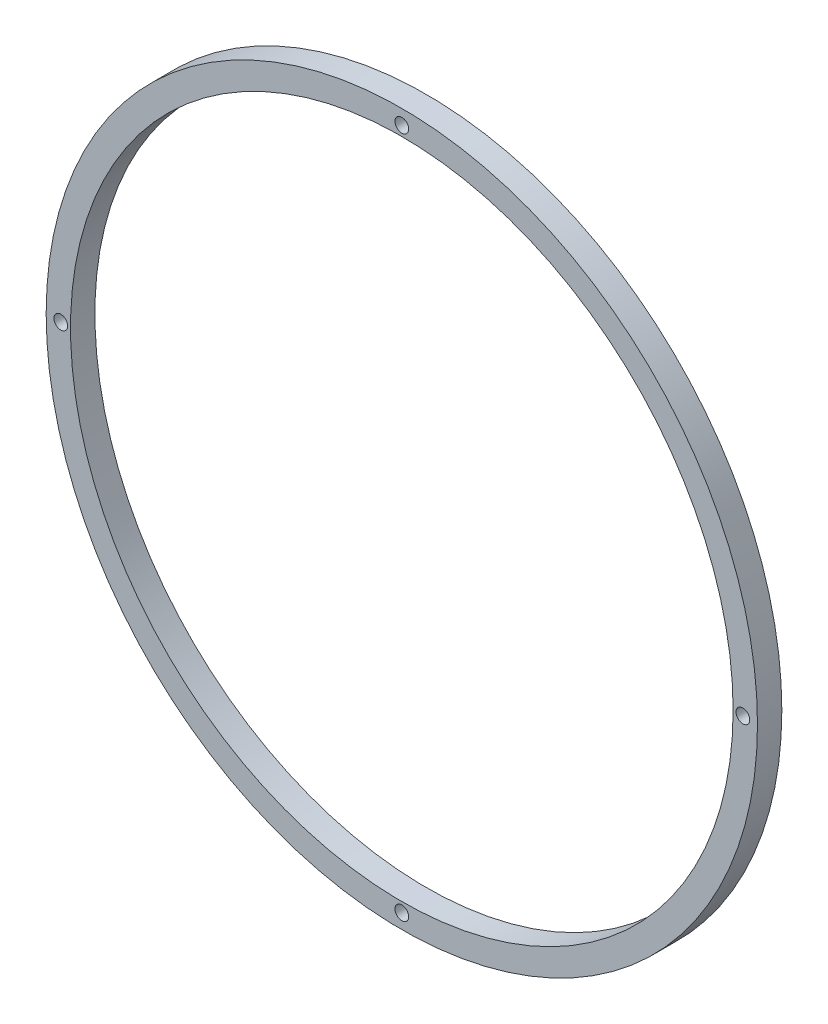
from build123d import *

# Parameters (mm, degrees)
SKETCH1_R           = 92.71
SKETCH1_R_2         = 1.7859375
SKETCH1_R_3         = 86.36
BOSS_EXTRUDE1_DEPTH = 6.35


with BuildPart() as part:
    # Sketch1 → Boss-Extrude1 (new body)
    with BuildSketch(Plane.XY):
        Circle(SKETCH1_R)
        with Locations((-88.9, 0)):
            Circle(SKETCH1_R_2, mode=Mode.SUBTRACT)
        with Locations((0, -88.9)):
            Circle(SKETCH1_R_2, mode=Mode.SUBTRACT)
        Circle(SKETCH1_R_3, mode=Mode.SUBTRACT)
        with Locations((88.9, 0)):
            Circle(SKETCH1_R_2, mode=Mode.SUBTRACT)
        with Locations((0, 88.9)):
            Circle(SKETCH1_R_2, mode=Mode.SUBTRACT)
    extrude(amount=BOSS_EXTRUDE1_DEPTH)


solid = part.part
